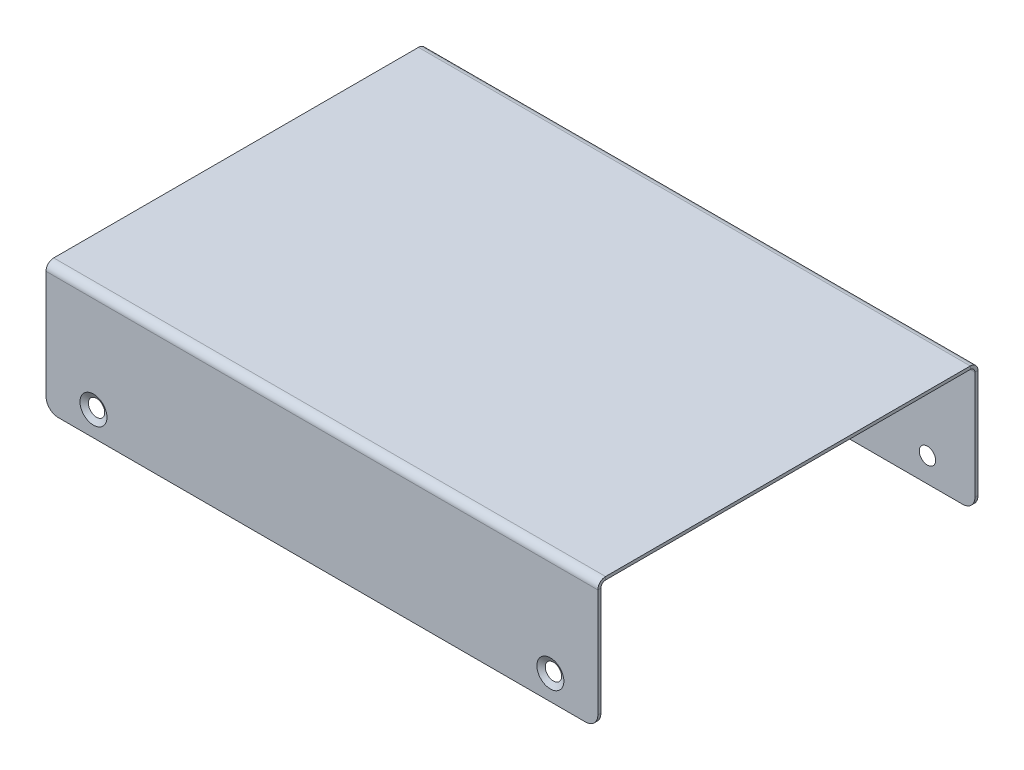
from build123d import *

# Parameters (mm, degrees)
SKETCH1_W                                      = 89.98
SKETCH1_H                                      = 60.99
BASE_FLANGE1_DEPTH                             = 0.5
EDGE_FLANGE1_STRIP_W                           = 3.51892
EDGE_FLANGE1_STRIP_H                           = 0.5
EDGE_FLANGE1_STRIP_CUT_DEPTH                   = 89.98
EDGE_FLANGE1_STRIP_2_W                         = 3.51892
EDGE_FLANGE1_STRIP_2_H                         = 0.5
EDGE_FLANGE1_STRIP_CUT_2_DEPTH                 = 89.98
EDGE_FLANGE1_DEPTH                             = 89.98
EDGE_FLANGE1_BEND_DEPTH                        = 89.98
CSK_FOR_M2_FLAT_HEAD_MACHINE_SCREW1_AT_2_COUNT = 2
CSK_FOR_M2_FLAT_HEAD_MACHINE_SCREW1_AT_2_PITCH = 74.5
CSK_FOR_M2_FLAT_HEAD_MACHINE_SCREW2_AT_2_COUNT = 2
CSK_FOR_M2_FLAT_HEAD_MACHINE_SCREW2_AT_2_PITCH = 74.5
FILLET1_R                                      = 2


# Sheet-metal steps are written as plain solids
with BuildPart() as part:
    # Sketch1 → Base-Flange1 (new body)
    with BuildSketch(Plane(origin=(0, 0, 0), x_dir=(1, 0, 0), z_dir=(0, 1, 0))):
        Rectangle(SKETCH1_W, SKETCH1_H)
    extrude(amount=-BASE_FLANGE1_DEPTH)

    # Edge-Flange1 strip (across the edge) → Edge-Flange1 strip cut (cut)
    with BuildSketch(Plane(origin=(44.99, -0.5, 30.495), x_dir=(0, 0, -1), z_dir=(-1, 0, 0))):
        with Locations((-1, -0.25)):
            Rectangle(EDGE_FLANGE1_STRIP_W, EDGE_FLANGE1_STRIP_H)
    extrude(amount=EDGE_FLANGE1_STRIP_CUT_DEPTH, mode=Mode.SUBTRACT)

    # Edge-Flange1 strip 2 (across the edge) → Edge-Flange1 strip cut 2 (cut)
    with BuildSketch(Plane(origin=(-44.99, -0.5, -30.495), x_dir=(0, 0, 1), z_dir=(1, 0, 0))):
        with Locations((-1, -0.25)):
            Rectangle(EDGE_FLANGE1_STRIP_2_W, EDGE_FLANGE1_STRIP_2_H)
    extrude(amount=EDGE_FLANGE1_STRIP_CUT_2_DEPTH, mode=Mode.SUBTRACT)

    # Edge-Flange1 section (across the edge) → Edge-Flange1 (add)
    with BuildSketch(Plane(origin=(44.99, -0.5, 30.495), x_dir=(0, 0, -1), z_dir=(-1, 0, 0))):
        with BuildLine():
            Line((-0.5, 0.75946), (-0.5, 20.42))
            Line((-0.5, 20.42), (0, 20.42))
            Line((0, 20.42), (0, 0.75946))
            ThreePointArc((0, 0.75946), (0.222440684, 0.222440684), (0.75946, 0))
            Line((0.75946, 0), (0.75946, -0.5))
            ThreePointArc((0.75946, -0.5), (-0.131112707, -0.131112707), (-0.5, 0.75946))
        make_face()
    extrude(amount=EDGE_FLANGE1_DEPTH)

    # Edge-Flange1 section 2 (across the edge) → Edge-Flange1 bend (add)
    with BuildSketch(Plane(origin=(-44.99, -0.5, -30.495), x_dir=(0, 0, 1), z_dir=(1, 0, 0))):
        with BuildLine():
            Line((-0.5, 0.75946), (-0.5, 20.42))
            Line((-0.5, 20.42), (0, 20.42))
            Line((0, 20.42), (0, 0.75946))
            ThreePointArc((0, 0.75946), (0.222440684, 0.222440684), (0.75946, 0))
            Line((0.75946, 0), (0.75946, -0.5))
            ThreePointArc((0.75946, -0.5), (-0.131112707, -0.131112707), (-0.5, 0.75946))
        make_face()
    extrude(amount=EDGE_FLANGE1_BEND_DEPTH)

    # Sketch14 → CSK for M2 Flat Head Machine Screw1 (revolve, cut)
    with BuildSketch(Plane(origin=(-37.25, -16.92, 30.995), x_dir=(0, -1, 0), z_dir=(1, 0, 0))):
        Polygon((0, 0), (0, 0.5), (1.2, 0.5), (1.2, 0.577350269), (2.2, 0), align=None)
    csk_for_m2_flat_head_machine_screw1 = revolve(axis=Axis((-37.25, -16.92, 37.345), (0, 0, -1)), mode=Mode.SUBTRACT)

    # CSK for M2 Flat Head Machine Screw1 at 2: CSK for M2 Flat Head Machine Screw1 ×2
    with Locations(*[(i * CSK_FOR_M2_FLAT_HEAD_MACHINE_SCREW1_AT_2_PITCH, 0, 0) for i in range(1, CSK_FOR_M2_FLAT_HEAD_MACHINE_SCREW1_AT_2_COUNT)]):
        add(csk_for_m2_flat_head_machine_screw1, mode=Mode.SUBTRACT)

    # Sketch20 → CSK for M2 Flat Head Machine Screw2 (revolve, cut)
    with BuildSketch(Plane(origin=(37.25, -16.92, -30.995), x_dir=(0, 1, 0), z_dir=(1, 0, 0))):
        Polygon((0, 0), (0, 0.5), (1.2, 0.5), (1.2, 0.577350269), (2.2, 0), align=None)
    csk_for_m2_flat_head_machine_screw2 = revolve(axis=Axis((37.25, -16.92, -37.345), (0, 0, 1)), mode=Mode.SUBTRACT)

    # CSK for M2 Flat Head Machine Screw2 at 2: CSK for M2 Flat Head Machine Screw2 ×2
    with Locations(*[(-i * CSK_FOR_M2_FLAT_HEAD_MACHINE_SCREW2_AT_2_PITCH, 0, 0) for i in range(1, CSK_FOR_M2_FLAT_HEAD_MACHINE_SCREW2_AT_2_COUNT)]):
        add(csk_for_m2_flat_head_machine_screw2, mode=Mode.SUBTRACT)

    # Fillet1
    fillet1_edges = [part.edges().sort_by_distance(p)[0] for p in [
        (44.99, -20.92, 30.745),
        (-44.99, -20.92, 30.745),
        (-44.99, -20.92, -30.745),
        (44.99, -20.92, -30.745),
    ]]
    fillet(fillet1_edges, radius=FILLET1_R)


solid = part.part
